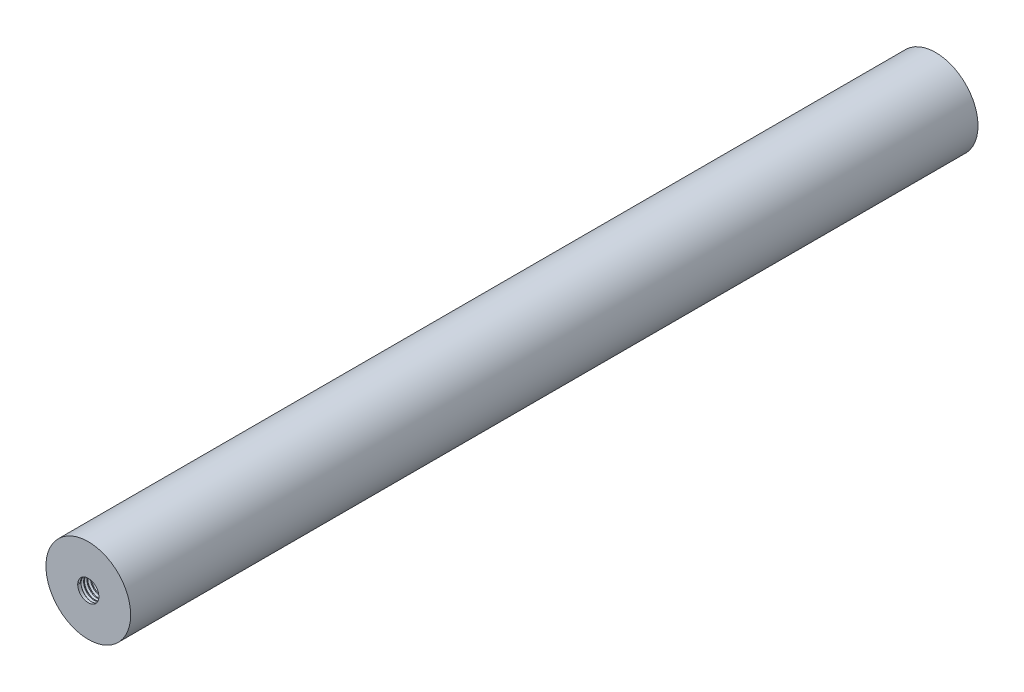
from build123d import *
from build123d.topology import SkipClean

# Parameters (mm, degrees)
SKETCH1_R           = 10
BOSS_EXTRUDE1_DEPTH = 200
SKETCH2_R           = 2.5
CUT_EXTRUDE1_DEPTH  = 6
THREAD1_PITCH       = 0.8


with BuildPart() as part:
    # Sketch1 → Boss-Extrude1 (new body)
    with BuildSketch(Plane.XY):
        Circle(SKETCH1_R)
    extrude(amount=-BOSS_EXTRUDE1_DEPTH)

    # Sketch2 → Cut-Extrude1 (cut)
    with BuildSketch(Plane.XY):
        Circle(SKETCH2_R)
    extrude(amount=-CUT_EXTRUDE1_DEPTH, mode=Mode.SUBTRACT)

    # Thread1: the profile of Thread Profile1 profile screwed along a right-hand helix of 7.5 turns, 8 arcs to a turn; built about Z, then put on its axis
    with SkipClean():  # the faces are left unmerged after this step: merging them gives an invalid solid
        thread1_z = Axis((0, 0, 0), (0, 0, 1))
        thread1_corners = [(2.4997, 0, -0.000173205), (2.9330127, 0, 0.249999999), (2.9330127, 0, 0.349999999), (2.4997, 0, 0.600173203)]
        with BuildLine(mode=Mode.PRIVATE) as thread1_profile:
            Line(thread1_corners[0], thread1_corners[1])
            Line(thread1_corners[1], thread1_corners[2])
            Line(thread1_corners[2], thread1_corners[3])
            Line(thread1_corners[3], thread1_corners[0])
        thread1_cap = Face(thread1_profile.wire())
        thread1_turn_angles = [0, 22.5, 45, 67.5, 90, 112.5, 135, 157.5, 180, 202.5, 225, 247.5, 270, 292.5, 315, 337.5, 360]
        thread1_turn_weights = [1, 0.9238795325112867, 1, 0.9238795325112867, 1, 0.9238795325112867, 1, 0.9238795325112867, 1, 0.9238795325112867, 1, 0.9238795325112867, 1, 0.9238795325112867, 1, 0.9238795325112867, 1]
        thread1_turn_rails = [Edge.make_bspline([Vector(p[0], p[1], 0).rotate(thread1_z, thread1_turn_angles[k]) / thread1_turn_weights[k] + Vector(0, 0, p[2] + THREAD1_PITCH * thread1_turn_angles[k] / 360) for k in range(17)], [0, 0, 0, 1, 1, 2, 2, 3, 3, 4, 4, 5, 5, 6, 6, 7, 7, 8, 8, 8], 2, thread1_turn_weights) for p in thread1_corners]
        thread1_turn_sides = [Face.make_surface_from_curves(thread1_turn_rails[p[0]], thread1_turn_rails[p[1]]) for p in [(0, 1), (1, 2), (2, 3), (3, 0)]]
        thread1_last_angles = [2520, 2542.5, 2565, 2587.5, 2610, 2632.5, 2655, 2677.5, 2700]
        thread1_last_weights = [1, 0.9238795325112867, 1, 0.9238795325112867, 1, 0.9238795325112867, 1, 0.9238795325112867, 1]
        thread1_last_rails = [Edge.make_bspline([Vector(p[0], p[1], 0).rotate(thread1_z, thread1_last_angles[k]) / thread1_last_weights[k] + Vector(0, 0, p[2] + THREAD1_PITCH * thread1_last_angles[k] / 360) for k in range(9)], [0, 0, 0, 1, 1, 2, 2, 3, 3, 4, 4, 4], 2, thread1_last_weights) for p in thread1_corners]
        thread1_last_sides = [Face.make_surface_from_curves(thread1_last_rails[p[0]], thread1_last_rails[p[1]]) for p in [(0, 1), (1, 2), (2, 3), (3, 0)]]
        thread1 = Plane(origin=(0, 0, 0), x_dir=(-1, 0, 0), z_dir=(0, 0, -1)) * Solid(Shell([*[p.moved(Location((0, 0, THREAD1_PITCH * i))) for i in range(7) for p in thread1_turn_sides], *thread1_last_sides, thread1_cap, thread1_cap.rotate(thread1_z, 2700).moved(Location((0, 0, THREAD1_PITCH * 2700 / 360)))]))
        add(thread1, mode=Mode.SUBTRACT)


solid = part.part
